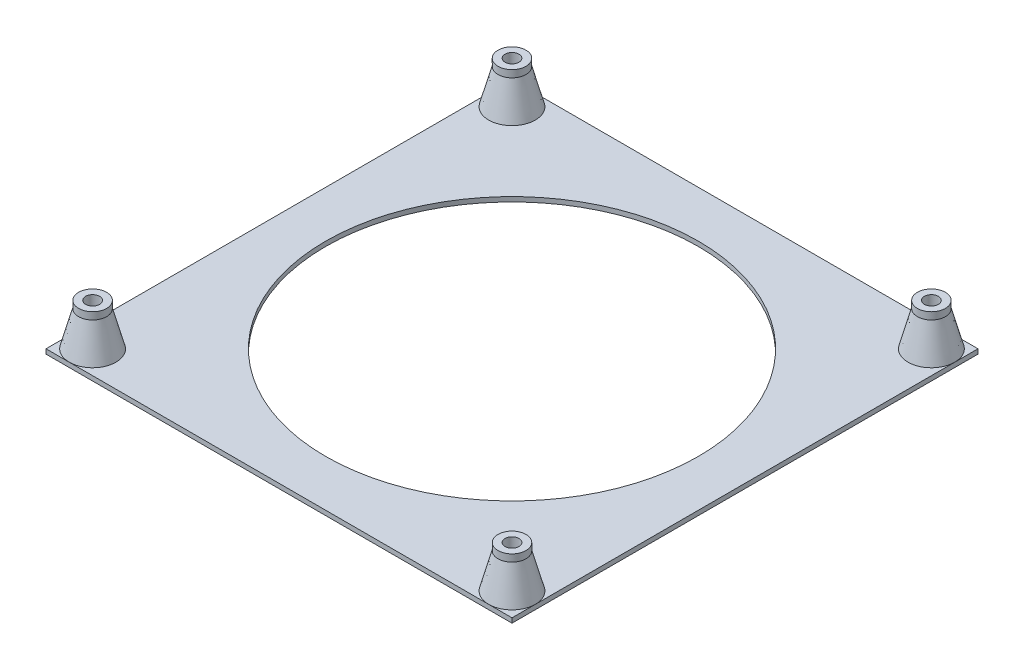
from build123d import *

# Parameters (mm, degrees)
SKETCH1_W                 = 100
SKETCH1_H                 = 100
SKETCH1_R                 = 40
BOSS_EXTRUDE1_DEPTH       = 1
SKETCH2_R                 = 3
SKETCH2_R_2               = 1.5
BOSS_EXTRUDE2_DEPTH       = 9
CUT_EXTRUDE1_START        = 9
SKETCH2_3_R               = 1.5
CUT_EXTRUDE1_DEPTH        = 10
MIRROR2_COPY_1_SKETCH_R   = 3
MIRROR2_COPY_1_SKETCH_R_2 = 1.5
MIRROR2_COPY_1_DEPTH      = 9
MIRROR2_START             = 9
MIRROR2_COPY_2_SKETCH_R   = 1.5
MIRROR2_COPY_2_DEPTH      = 10
CHAMFER1_SIZE             = 2
CHAMFER1_SIZE_2           = 7.464101615


with BuildPart() as part:
    # Sketch1 → Boss-Extrude1 (new body)
    with BuildSketch(Plane(origin=(0, 0, 0), x_dir=(1, 0, 0), z_dir=(0, 1, 0))):
        Rectangle(SKETCH1_W, SKETCH1_H)
        with Locations(Location((0, 0, 0), (0, 0, 270))):
            Circle(SKETCH1_R, mode=Mode.SUBTRACT)
    extrude(amount=BOSS_EXTRUDE1_DEPTH)

    # Sketch2 → Boss-Extrude2 (add)
    # profile 1 of 2: a face of its own
    with BuildSketch(Plane(origin=(0, 1, 0), x_dir=(1, 0, 0), z_dir=(0, 1, 0))):
        with Locations(Location((-45, -45, 0), (0, 0, 270))):
            Circle(SKETCH2_R)
        with Locations((-45, -45)):
            Circle(SKETCH2_R_2, mode=Mode.SUBTRACT)
    # profile 2 of 2: a face of its own
    with BuildSketch(Plane(origin=(0, 1, 0), x_dir=(1, 0, 0), z_dir=(0, 1, 0))):
        with Locations((-45, -45)):
            Circle(SKETCH2_R_2)
    boss_extrude2 = extrude(amount=BOSS_EXTRUDE2_DEPTH)

    # Sketch2<3> → Cut-Extrude1 (cut)
    with BuildSketch(Plane(origin=(0, 1, 0), x_dir=(1, 0, 0), z_dir=(0, 1, 0)).offset(CUT_EXTRUDE1_START)):
        with Locations(Location((-45, -45, 0), (0, 0, 270))):
            Circle(SKETCH2_3_R)
    cut_extrude1 = extrude(amount=-CUT_EXTRUDE1_DEPTH, mode=Mode.SUBTRACT)

    # Mirror1: Boss-Extrude2, Cut-Extrude1 across plane
    add(boss_extrude2.mirror(Plane(origin=(0, 0, 0), x_dir=(0, 0, 1), z_dir=(1, 0, 0))))
    add(cut_extrude1.mirror(Plane(origin=(0, 0, 0), x_dir=(0, 0, 1), z_dir=(1, 0, 0))), mode=Mode.SUBTRACT)

    # Mirror2: Boss-Extrude2, Cut-Extrude1 across plane
    add(boss_extrude2.mirror(Plane.XY))
    add(cut_extrude1.mirror(Plane.XY), mode=Mode.SUBTRACT)

    # Mirror2 copy 1 sketch → Mirror2 copy 1 (add)
    # profile 1 of 2: a face of its own
    with BuildSketch(Plane(origin=(0, 1, 0), x_dir=(-1, 0, 0), z_dir=(0, 1, 0))):
        with Locations(Location((-45, -45, 0), (0, 0, 270))):
            Circle(MIRROR2_COPY_1_SKETCH_R)
        with Locations((-45, -45)):
            Circle(MIRROR2_COPY_1_SKETCH_R_2, mode=Mode.SUBTRACT)
    # profile 2 of 2: a face of its own
    with BuildSketch(Plane(origin=(0, 1, 0), x_dir=(-1, 0, 0), z_dir=(0, 1, 0))):
        with Locations((-45, -45)):
            Circle(MIRROR2_COPY_1_SKETCH_R_2)
    extrude(amount=MIRROR2_COPY_1_DEPTH)

    # Mirror2 copy 2 sketch → Mirror2 copy 2 (cut)
    with BuildSketch(Plane(origin=(0, 1, 0), x_dir=(-1, 0, 0), z_dir=(0, 1, 0)).offset(MIRROR2_START)):
        with Locations(Location((-45, -45, 0), (0, 0, 270))):
            Circle(MIRROR2_COPY_2_SKETCH_R)
    extrude(amount=-MIRROR2_COPY_2_DEPTH, mode=Mode.SUBTRACT)

    # Chamfer1
    # the kernel refuses this chamfer: 7.464101615, 2 mm, written as the material it adds along each edge
    with BuildSketch(Plane(origin=(-45, 1, 45), x_dir=(0, 0, 1), z_dir=(-1, 0, 0))) as chamfer1_piece_1_section:
        Polygon((3 + CHAMFER1_SIZE, 0), (3, CHAMFER1_SIZE_2), (3, 0), align=None)
    chamfer1_piece_1 = revolve(axis=Axis((-45, 1, 45), (0, 1, 0)), mode=Mode.PRIVATE)
    chamfer1_piece_1 = split(chamfer1_piece_1, bisect_by=Plane(origin=(-45, 4.716774414, 50), z_dir=(0, 0, -1)), keep=Keep.TOP, mode=Mode.PRIVATE)
    chamfer1_piece_1 = split(chamfer1_piece_1, bisect_by=Plane(origin=(-50, 4.716774414, 41.057012278), z_dir=(1, 0, 0)), keep=Keep.TOP, mode=Mode.PRIVATE)
    add(chamfer1_piece_1)
    with BuildSketch(Plane(origin=(45, 1, 45), x_dir=(0, 0, 1), z_dir=(1, 0, 0))) as chamfer1_piece_2_section:
        Polygon((3 + CHAMFER1_SIZE, 0), (3, -CHAMFER1_SIZE_2), (3, 0), align=None)
    chamfer1_piece_2 = revolve(axis=Axis((45, 1, 45), (0, -1, 0)), mode=Mode.PRIVATE)
    chamfer1_piece_2 = split(chamfer1_piece_2, bisect_by=Plane(origin=(45, 4.716774414, 50), z_dir=(0, 0, -1)), keep=Keep.TOP, mode=Mode.PRIVATE)
    chamfer1_piece_2 = split(chamfer1_piece_2, bisect_by=Plane(origin=(50, 4.716774414, 41.057012278), z_dir=(-1, 0, 0)), keep=Keep.TOP, mode=Mode.PRIVATE)
    add(chamfer1_piece_2)
    with BuildSketch(Plane(origin=(45, 1, -45), x_dir=(0, 0, -1), z_dir=(1, 0, 0))) as chamfer1_piece_3_section:
        Polygon((3 + CHAMFER1_SIZE, 0), (3, CHAMFER1_SIZE_2), (3, 0), align=None)
    chamfer1_piece_3 = revolve(axis=Axis((45, 1, -45), (0, 1, 0)), mode=Mode.PRIVATE)
    chamfer1_piece_3 = split(chamfer1_piece_3, bisect_by=Plane(origin=(50, 4.716774414, -41.057012278), z_dir=(-1, 0, 0)), keep=Keep.TOP, mode=Mode.PRIVATE)
    chamfer1_piece_3 = split(chamfer1_piece_3, bisect_by=Plane(origin=(45, 4.716774414, -50), z_dir=(0, 0, 1)), keep=Keep.TOP, mode=Mode.PRIVATE)
    add(chamfer1_piece_3)
    with BuildSketch(Plane(origin=(-45, 1, -45), x_dir=(0, 0, -1), z_dir=(-1, 0, 0))) as chamfer1_piece_4_section:
        Polygon((3 + CHAMFER1_SIZE, 0), (3, -CHAMFER1_SIZE_2), (3, 0), align=None)
    chamfer1_piece_4 = revolve(axis=Axis((-45, 1, -45), (0, -1, 0)), mode=Mode.PRIVATE)
    chamfer1_piece_4 = split(chamfer1_piece_4, bisect_by=Plane(origin=(-50, 4.716774414, -41.057012278), z_dir=(1, 0, 0)), keep=Keep.TOP, mode=Mode.PRIVATE)
    chamfer1_piece_4 = split(chamfer1_piece_4, bisect_by=Plane(origin=(-45, 4.716774414, -50), z_dir=(0, 0, 1)), keep=Keep.TOP, mode=Mode.PRIVATE)
    add(chamfer1_piece_4)


solid = part.part
